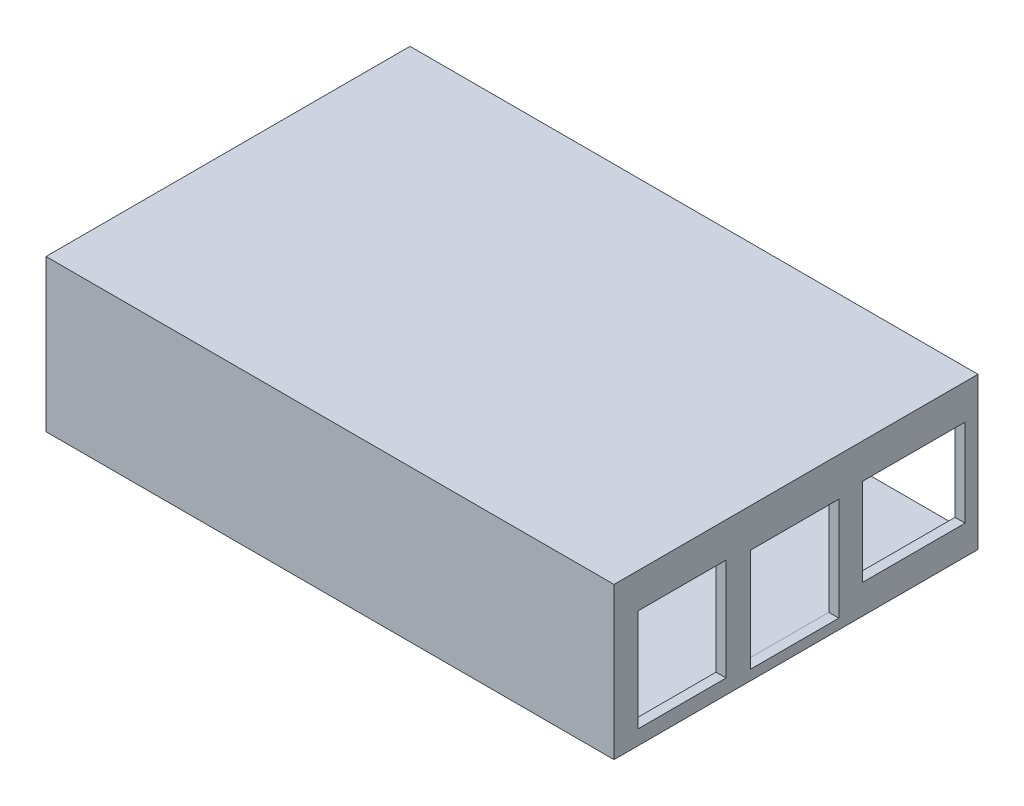
from build123d import *

# Parameters (mm, degrees)
AUFSATZ_LINEAR_AUSTRAGEN1_DEPTH = 88.6
SKIZZE3_W                       = 57.8
SKIZZE3_H                       = 24.1
SKIZZE3_R                       = 1.5
SKIZZE3_W_2                     = 12.55
SKIZZE3_H_2                     = 1.71
AUFSATZ_LINEAR_AUSTRAGEN2_DEPTH = 1.6
SKIZZE4_W                       = 57.8
SKIZZE4_H                       = 24.1
SKIZZE4_W_2                     = 14
SKIZZE4_H_2                     = 16.36262465
SKIZZE4_H_3                     = 16.22
SKIZZE4_W_3                     = 16.3
SKIZZE4_H_4                     = 13.9
AUFSATZ_LINEAR_AUSTRAGEN3_DEPTH = 1.6


# Read off the part's stored shape, not the designer's step: Aufsatz-Linear austragen1
with BuildPart() as part:
    # Aufsatz-Linear austragen1 outline → Aufsatz-Linear austragen1 (new body)
    with BuildSketch(Plane(origin=(-0.2, 0, 0), x_dir=(0, 0, -1), z_dir=(1, 0, 0))):
        Polygon((0, 2.7), (0, 4.3), (-57.8, 4.3), (-57.8, -19.8), (0, -19.8), (0, -18.2), (-56.2, -18.2), (-56.2, 2.7), align=None)
    extrude(amount=AUFSATZ_LINEAR_AUSTRAGEN1_DEPTH)

    # Skizze3 → Aufsatz-Linear austragen2 (add)
    with BuildSketch(Plane(origin=(-0.2, 0, 0), x_dir=(0, 0, -1), z_dir=(1, 0, 0))):
        with Locations((-28.9, -7.75)):
            Rectangle(SKIZZE3_W, SKIZZE3_H)
        with Locations((-18.399365347, -3.04590093)):
            Circle(SKIZZE3_R, mode=Mode.SUBTRACT)
        with Locations((-27.975, 0.725)):
            Rectangle(SKIZZE3_W_2, SKIZZE3_H_2, mode=Mode.SUBTRACT)
    extrude(amount=-AUFSATZ_LINEAR_AUSTRAGEN2_DEPTH)

    # Skizze4 → Aufsatz-Linear austragen3 (add)
    with BuildSketch(Plane(origin=(88.4, 0, 0), x_dir=(0, 0, -1), z_dir=(1, 0, 0))):
        with Locations((-28.9, -7.75)):
            Rectangle(SKIZZE4_W, SKIZZE4_H)
        with Locations((-29.1, -10.011312325)):
            Rectangle(SKIZZE4_W_2, SKIZZE4_H_2, mode=Mode.SUBTRACT)
        with Locations((-47, -9.36)):
            Rectangle(SKIZZE4_W_2, SKIZZE4_H_3, mode=Mode.SUBTRACT)
        with Locations((-10.2, -8.2)):
            Rectangle(SKIZZE4_W_3, SKIZZE4_H_4, mode=Mode.SUBTRACT)
    extrude(amount=-AUFSATZ_LINEAR_AUSTRAGEN3_DEPTH)


solid = part.part
